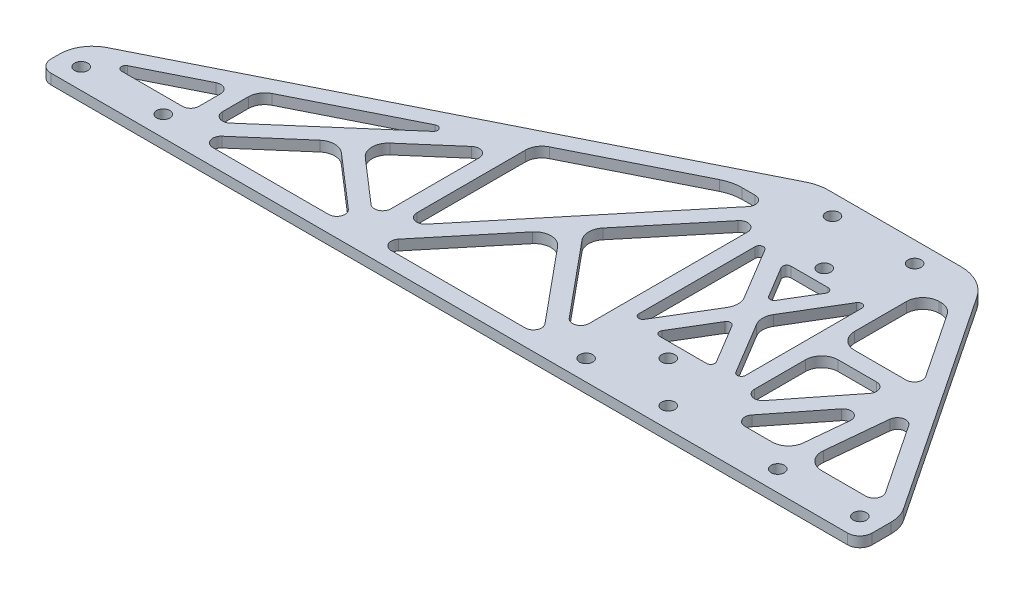
from build123d import *

# Parameters (mm, degrees)
SKETCH1_R           = 2.032
BOSS_EXTRUDE1_DEPTH = 3.175
SKETCH1_3_R         = 2.032
CUT_EXTRUDE2_DEPTH  = 270.126904313
FILLET1_R           = 3.81
FILLET2_R           = 10.16
FILLET3_R           = 12.7
FILLET4_R           = 1.27
FILLET5_R           = 2.54
FILLET6_R           = 5.08
FILLET7_R           = 12.7


with BuildPart() as part:
    # Sketch1 → Boss-Extrude1 (new body)
    with BuildSketch(Plane(origin=(0, 0, 0), x_dir=(1, 0, 0), z_dir=(0, 1, 0))):
        Polygon((0, 0), (254, 0), (254, 12.7), (203.2, 88.9), (152.4, 88.9), (0, 12.7), align=None)
        with Locations((6.773333333, 6.35)):
            Circle(SKETCH1_R, mode=Mode.SUBTRACT)
        with Locations((32.173333333, 6.35)):
            Circle(SKETCH1_R, mode=Mode.SUBTRACT)
        with Locations((222.25, 6.35)):
            Circle(SKETCH1_R, mode=Mode.SUBTRACT)
        with Locations((247.65, 6.35)):
            Circle(SKETCH1_R, mode=Mode.SUBTRACT)
        with Locations((162.983333333, 82.55)):
            Circle(SKETCH1_R, mode=Mode.SUBTRACT)
        with Locations((188.383333333, 82.55)):
            Circle(SKETCH1_R, mode=Mode.SUBTRACT)
    extrude(amount=BOSS_EXTRUDE1_DEPTH)

    # Sketch1<3> → Cut-Extrude2 (cut, through all)
    with BuildSketch(Plane(origin=(0, 0, 0), x_dir=(1, 0, 0), z_dir=(0, 1, 0))):
        Polygon((8.819225326, 11.43), (35.56, 11.43), (35.56, 24.800387337), align=None)
        Polygon((66.675, 26.500492708), (41.976692895, 5.08), (91.373307105, 5.08), align=None)
        Polygon((40.64, 27.340387337), (40.64, 10.645107065), (86.095819954, 50.068297314), align=None)
        Polygon((98.546680512, 5.08), (150.796652822, 5.08), (124.671666667, 36.655522835), align=None)
        Polygon((150.796652822, 76.2), (138.359225326, 76.2), (97.79, 55.915387337), (97.79, 12.134405223), align=None)
        with Locations((188.383333333, 6.35)):
            Circle(SKETCH1_3_R)
        Polygon((92.71, 49.080280272), (70.551692895, 29.862693669), (92.71, 10.645107065), align=None)
        Polygon((154.093333333, 72.215522835), (127.968347178, 40.64), (154.093333333, 9.064477165), align=None)
        with Locations((162.983333333, 6.35)):
            Circle(SKETCH1_3_R)
        Polygon((223.00729992, 50.03094988), (205.561266507, 76.2), (197.273333333, 76.2), (197.273333333, 50.03094988), align=None)
        with BuildLine():
            Line((221.333484531, 39.117053196), (200.507711061, 12.7))
            Line((200.507711061, 12.7), (218.773966587, 12.7))
            ThreePointArc((218.773966587, 12.7), (218.776955674, 12.823189397), (218.7859159, 12.946088854))
            Line((218.7859159, 12.946088854), (221.333484531, 39.117053196))
        make_face()
        Polygon((197.273333333, 44.95094988), (197.273333333, 16.802739743), (219.463857142, 44.95094988), align=None)
        Polygon((166.148656896, 23.622), (185.218009771, 23.622), (175.683333333, 39.513127396), align=None)
        Polygon((178.645456896, 44.45), (192.193333333, 21.870205938), (192.193333333, 67.029794062), align=None)
        Polygon((172.721209771, 44.45), (159.173333333, 67.029794062), (159.173333333, 21.870205938), align=None)
        Polygon((223.865972381, 12.7), (247.89459984, 12.7), (226.927485283, 44.150671836), align=None)
        Polygon((183.694009771, 62.738), (167.672656896, 62.738), (175.683333333, 49.386872604), align=None)
        with Locations((175.683333333, 19.05)):
            Circle(SKETCH1_3_R)
        with Locations((175.683333333, 67.31)):
            Circle(SKETCH1_3_R)
    extrude(amount=CUT_EXTRUDE2_DEPTH, mode=Mode.SUBTRACT)

    # Fillet1
    fillet1_edges = [part.edges().sort_by_distance(p)[0] for p in [
        (254, 1.5875, 0),
        (0, 1.5875, 0),
    ]]
    fillet(fillet1_edges, radius=FILLET1_R)

    # Fillet2
    fillet2_edges = [part.edges().sort_by_distance(p)[0] for p in [
        (254, 1.5875, -12.7),
        (0, 1.5875, -12.7),
    ]]
    fillet(fillet2_edges, radius=FILLET2_R)

    # Fillet3
    fillet3_edges = [part.edges().sort_by_distance(p)[0] for p in [
        (203.2, 1.5875, -88.9),
        (152.4, 1.5875, -88.9),
    ]]
    fillet(fillet3_edges, radius=FILLET3_R)

    # Fillet4
    fillet4_edges = [part.edges().sort_by_distance(p)[0] for p in [
        (159.173333333, 1.5875, -67.029794062),
        (192.193333333, 1.5875, -67.029794062),
        (192.193333333, 1.5875, -21.870205938),
        (159.173333333, 1.5875, -21.870205938),
        (183.694009771, 1.5875, -62.738),
        (167.672656896, 1.5875, -62.738),
        (175.683333333, 1.5875, -49.386872604),
        (185.218009771, 1.5875, -23.622),
        (166.148656896, 1.5875, -23.622),
        (175.683333333, 1.5875, -39.513127396),
        (86.095819954, 1.5875, -50.068297314),
        (8.819225326, 1.5875, -11.43),
    ]]
    fillet(fillet4_edges, radius=FILLET4_R)

    # Fillet5
    fillet5_edges = [part.edges().sort_by_distance(p)[0] for p in [
        (223.00729992, 1.5875, -50.03094988),
        (247.89459984, 1.5875, -12.7),
        (226.927485283, 1.5875, -44.150671836),
        (221.333484531, 1.5875, -39.117053196),
        (200.507711061, 1.5875, -12.7),
        (197.273333333, 1.5875, -16.802739743),
        (219.463857142, 1.5875, -44.95094988),
        (97.79, 1.5875, -12.134405223),
        (92.71, 1.5875, -49.080280272),
        (41.976692895, 1.5875, -5.08),
        (91.373307105, 1.5875, -5.08),
        (92.71, 1.5875, -10.645107065),
        (98.546680512, 1.5875, -5.08),
        (150.796652822, 1.5875, -5.08),
        (154.093333333, 1.5875, -9.064477165),
        (154.093333333, 1.5875, -72.215522835),
        (150.796652822, 1.5875, -76.2),
        (35.56, 1.5875, -24.800387337),
        (35.56, 1.5875, -11.43),
        (40.64, 1.5875, -10.645107065),
    ]]
    fillet(fillet5_edges, radius=FILLET5_R)

    # Fillet6
    fillet6_edges = [part.edges().sort_by_distance(p)[0] for p in [
        (172.721209771, 1.5875, -44.45),
        (178.645456896, 1.5875, -44.45),
        (223.865972381, 1.5875, -12.7),
        (218.773966587, 1.5875, -12.7),
        (197.273333333, 1.5875, -50.03094988),
        (197.273333333, 1.5875, -44.95094988),
        (197.273333333, 1.5875, -76.2),
        (205.561266507, 1.5875, -76.2),
        (66.675, 1.5875, -26.500492708),
        (70.551692895, 1.5875, -29.862693669),
        (97.79, 1.5875, -55.915387337),
        (127.968347178, 1.5875, -40.64),
        (124.671666667, 1.5875, -36.655522835),
        (40.64, 1.5875, -27.340387337),
    ]]
    fillet(fillet6_edges, radius=FILLET6_R)

    # Fillet7
    fillet7_edges = [part.edges().sort_by_distance(p)[0] for p in [
        (138.359225326, 1.5875, -76.2),
    ]]
    fillet(fillet7_edges, radius=FILLET7_R)


solid = part.part
